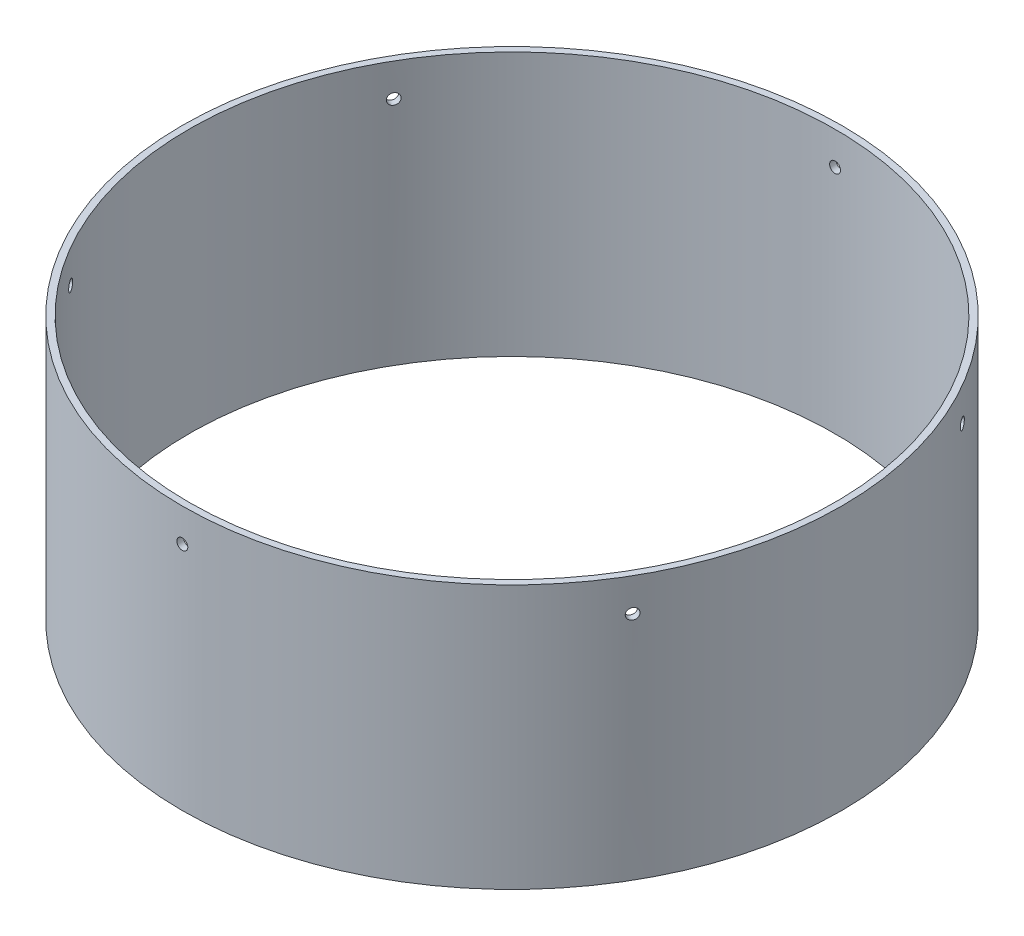
from build123d import *

# Parameters (mm, degrees)
SKETCH1_R           = 100
SKETCH1_R_2         = 98
BOSS_EXTRUDE1_DEPTH = 80
F_3DSKETCH1_R       = 1.65
CUT_EXTRUDE1_DEPTH  = 158.797338381
CIRPATTERN1_COUNT   = 3


with BuildPart() as part:
    # Sketch1 → Boss-Extrude1 (new body)
    with BuildSketch(Plane(origin=(0, 0, 0), x_dir=(1, 0, 0), z_dir=(0, 1, 0))):
        Circle(SKETCH1_R)
        Circle(SKETCH1_R_2, mode=Mode.SUBTRACT)
    extrude(amount=BOSS_EXTRUDE1_DEPTH)

    # 3DSketch1 → Cut-Extrude1 (cut, symmetric)
    with BuildSketch(Plane(origin=(0, 70, 0), x_dir=(1, 0, 0), z_dir=(0, 0, 1))):
        Circle(F_3DSKETCH1_R)
    cut_extrude1 = extrude(amount=CUT_EXTRUDE1_DEPTH, both=True, mode=Mode.SUBTRACT)

    # CirPattern1: Cut-Extrude1 ×3 about axis
    cirpattern1_axis = Axis((0, 80, 0), (0, -1, 0))
    for i in range(1, CIRPATTERN1_COUNT):
        add(cut_extrude1.rotate(cirpattern1_axis, i * 360 / CIRPATTERN1_COUNT), mode=Mode.SUBTRACT)


solid = part.part
